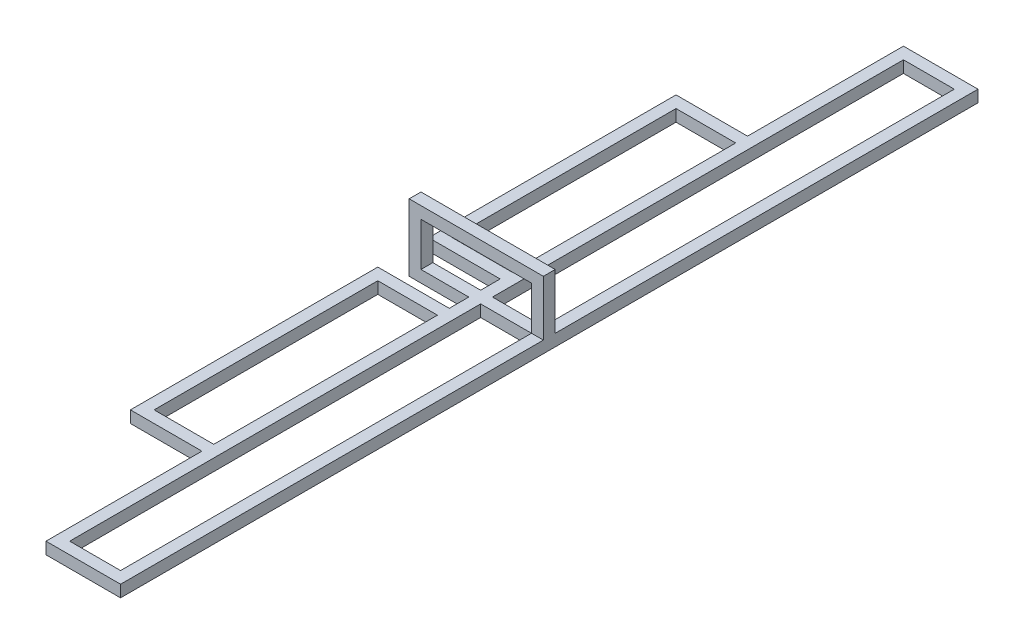
from build123d import *

# Parameters (mm, degrees)
SKETCH1_W           = 100
SKETCH1_H           = 1150
SKETCH1_W_2         = 68.25
SKETCH1_H_2         = 1118.25
BOSS_EXTRUDE1_DEPTH = 15.875
SKETCH3_W           = 111.75
SKETCH3_H           = 331.75
SKETCH3_W_2         = 80
SKETCH3_H_2         = 300
BOSS_EXTRUDE2_DEPTH = 15.875
SKETCH5_W           = 180
SKETCH5_H           = 90
SKETCH5_W_2         = 148.25
SKETCH5_H_2         = 58.25
BOSS_EXTRUDE3_DEPTH = 7.9375


with BuildPart() as part:
    # Sketch1 → Boss-Extrude1 (new body)
    with BuildSketch(Plane(origin=(0, 0, 0), x_dir=(1, 0, 0), z_dir=(0, 1, 0))):
        Rectangle(SKETCH1_W, SKETCH1_H)
        Rectangle(SKETCH1_W_2, SKETCH1_H_2, mode=Mode.SUBTRACT)
    extrude(amount=BOSS_EXTRUDE1_DEPTH)

    # Sketch3 → Boss-Extrude2 (add)
    # profile 1 of 2: a face of its own
    with BuildSketch(Plane(origin=(0, 15.875, 0), x_dir=(1, 0, 0), z_dir=(0, 1, 0))):
        with Locations((-90, 200)):
            Rectangle(SKETCH3_W, SKETCH3_H)
        with Locations((-90, 200)):
            Rectangle(SKETCH3_W_2, SKETCH3_H_2, mode=Mode.SUBTRACT)
    # profile 2 of 2: a face of its own
    with BuildSketch(Plane(origin=(0, 15.875, 0), x_dir=(1, 0, 0), z_dir=(0, 1, 0))):
        with Locations((-90, -200)):
            Rectangle(SKETCH3_W, SKETCH3_H)
        with Locations((-90, -200)):
            Rectangle(SKETCH3_W_2, SKETCH3_H_2, mode=Mode.SUBTRACT)
    extrude(amount=-BOSS_EXTRUDE2_DEPTH)

    # Sketch5 → Boss-Extrude3 (add, symmetric)
    with BuildSketch(Plane.XY):
        with Locations((-40, 45)):
            Rectangle(SKETCH5_W, SKETCH5_H)
        with Locations((-40, 45)):
            Rectangle(SKETCH5_W_2, SKETCH5_H_2, mode=Mode.SUBTRACT)
    extrude(amount=BOSS_EXTRUDE3_DEPTH, both=True)


solid = part.part
